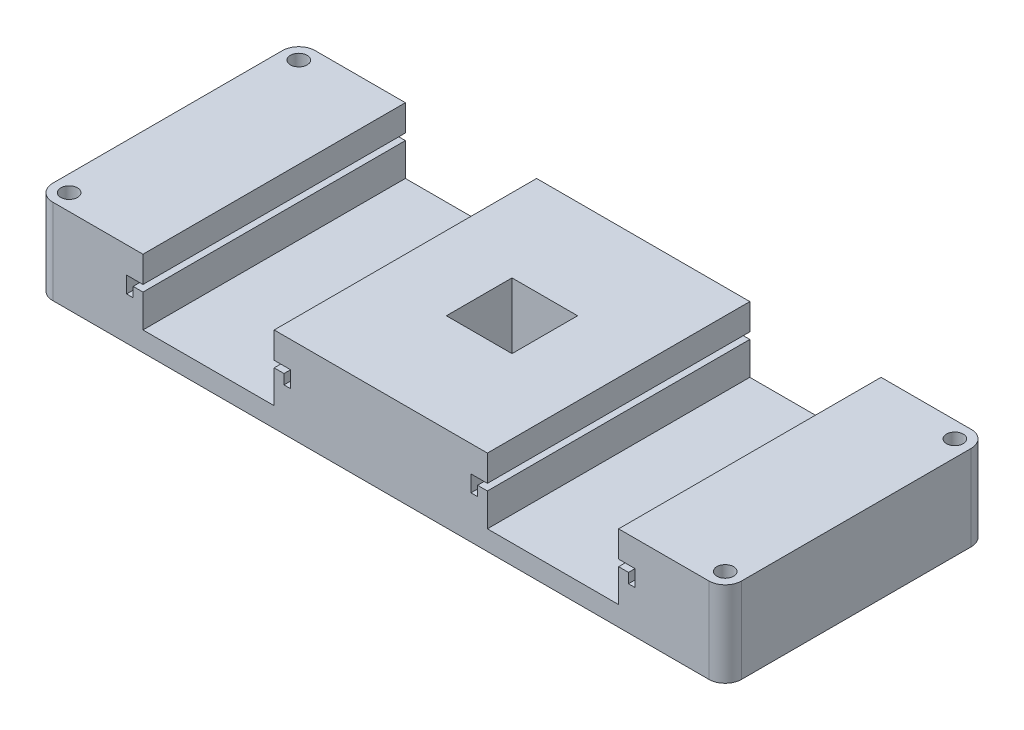
from build123d import *

# Parameters (mm, degrees)
BOSS_EXTRUDE1_DEPTH     = 26
SKETCH2_W               = 40
SKETCH2_H               = 20
CUT_EXTRUDE1_DEPTH      = 227.221130755
F_1_4_20_TAPPED_HOLE1_D = 5.1054
SKETCH4_W               = 20
SKETCH4_H               = 20
CUT_EXTRUDE2_DEPTH      = 227.221130755
CUT_EXTRUDE3_DEPTH      = 227.221130755


with BuildPart() as part:
    # Sketch1 → Boss-Extrude1 (new body)
    with BuildSketch(Plane(origin=(0, 0, 0), x_dir=(1, 0, 0), z_dir=(0, 1, 0))):
        with BuildLine():
            Line((5, 0), (205, 0))
            ThreePointArc((205, 0), (208.535533906, 1.464466094), (210, 5))
            Line((210, 5), (210, 75))
            ThreePointArc((210, 75), (208.535533906, 78.535533906), (205, 80))
            Line((205, 80), (5, 80))
            ThreePointArc((5, 80), (1.464466094, 78.535533906), (0, 75))
            Line((0, 75), (0, 5))
            ThreePointArc((0, 5), (1.464466094, 1.464466094), (5, 0))
        make_face()
    extrude(amount=BOSS_EXTRUDE1_DEPTH)

    # Sketch2 → Cut-Extrude1 (cut, through all)
    with BuildSketch(Plane.XY):
        with Locations((52.5, 16)):
            Rectangle(SKETCH2_W, SKETCH2_H)
        with Locations((157.5, 16)):
            Rectangle(SKETCH2_W, SKETCH2_H)
    extrude(amount=-CUT_EXTRUDE1_DEPTH, mode=Mode.SUBTRACT)

    # 1/4-20 Tapped Hole1 (through all)
    with Locations(Plane(origin=(5, 26, -75), x_dir=(0, 0, 1), z_dir=(0, 1, 0))):
        with Locations((0, 0), (70, 0), (70, 200), (0, 200)):
            Hole(F_1_4_20_TAPPED_HOLE1_D / 2)

    # Sketch4 → Cut-Extrude2 (cut, through all)
    with BuildSketch(Plane(origin=(0, 26, 0), x_dir=(1, 0, 0), z_dir=(0, 1, 0))):
        with Locations((105, 40)):
            Rectangle(SKETCH4_W, SKETCH4_H)
    extrude(amount=-CUT_EXTRUDE2_DEPTH, mode=Mode.SUBTRACT)

    # Sketch5 → Cut-Extrude3 (cut, through all)
    with BuildSketch(Plane.XY):
        Polygon((32.5, 18), (27.5, 18), (27.5, 13), (29.5, 13), (29.5, 16), (32.5, 16), align=None)
        Polygon((75.5, 16), (72.5, 16), (72.5, 18), (77.5, 18), (77.5, 13), (75.5, 13), align=None)
        Polygon((134.5, 13), (134.5, 16), (137.5, 16), (137.5, 18), (132.5, 18), (132.5, 13), align=None)
        Polygon((180.5, 16), (177.5, 16), (177.5, 18), (182.5, 18), (182.5, 13), (180.5, 13), align=None)
    extrude(amount=-CUT_EXTRUDE3_DEPTH, mode=Mode.SUBTRACT)


solid = part.part
